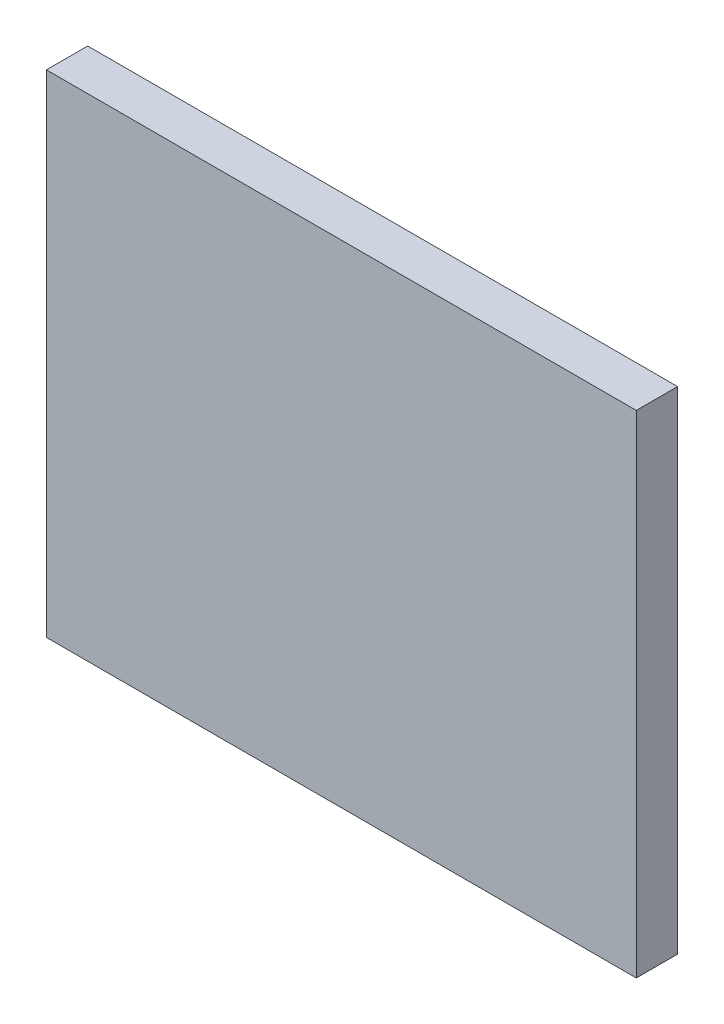
from build123d import *

# Parameters (mm, degrees)
SKIZZE1_W                       = 300
SKIZZE1_H                       = 250
AUFSATZ_LINEAR_AUSTRAGEN1_DEPTH = 21


with BuildPart() as part:
    # Skizze1 → Aufsatz-Linear austragen1 (new body)
    with BuildSketch(Plane.XY):
        with Locations((150, 125)):
            Rectangle(SKIZZE1_W, SKIZZE1_H)
    extrude(amount=AUFSATZ_LINEAR_AUSTRAGEN1_DEPTH)


solid = part.part
